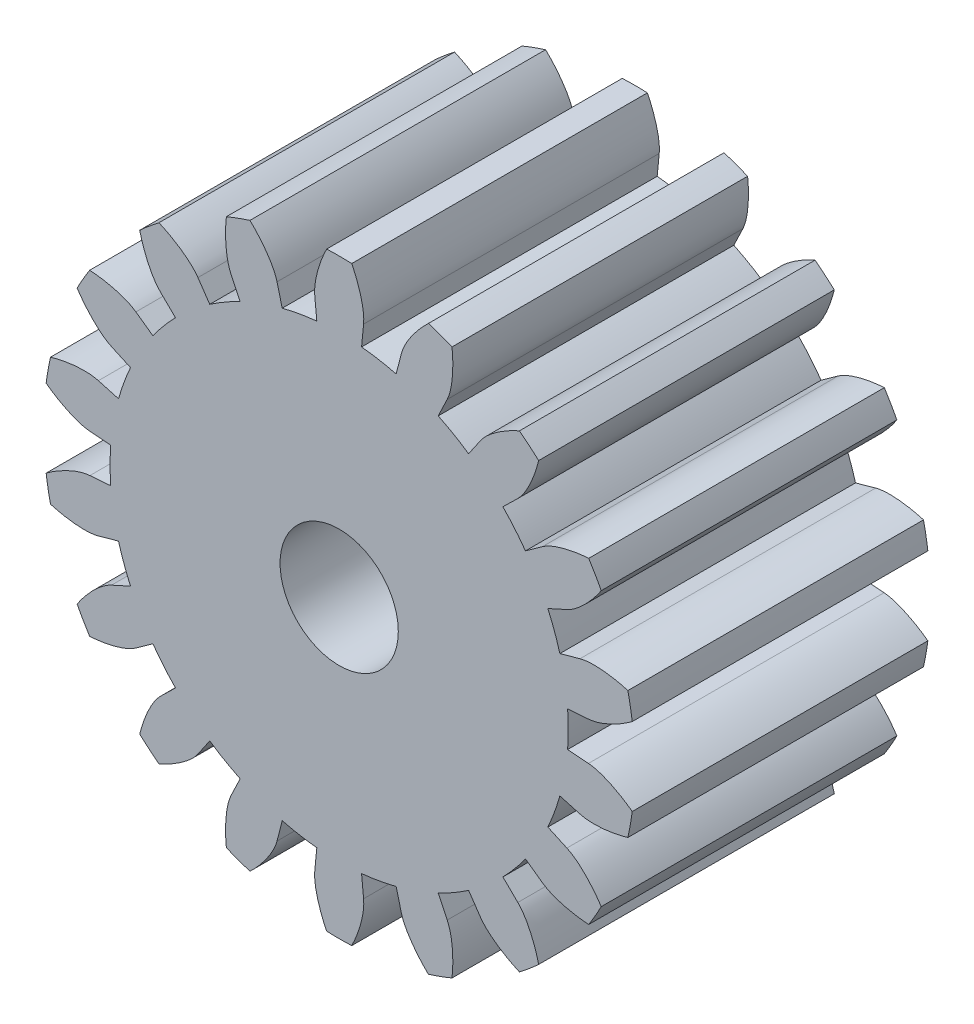
from build123d import *

# Parameters (mm, degrees)
SKETCH_1_R               = 5
SKETCH_1_R_2             = 1
EXTRUDE_1_DEPTH          = 5
CUT_EXTRUDE_1_DEPTH      = 9.660254038
PATTERN_CIRCULAR_1_COUNT = 18
PATTERN_CIRCULAR_1_ANGLE = 340


with BuildPart() as part:
    # 草图1 → 凸台-拉伸1 (new body)
    with BuildSketch(Plane.XY):
        Circle(SKETCH_1_R)
        Circle(SKETCH_1_R_2, mode=Mode.SUBTRACT)
    extrude(amount=EXTRUDE_1_DEPTH)

    # 草图1<3> → 切除-拉伸1 (cut, through all)
    with BuildSketch(Plane.XY):
        with BuildLine():
            Line((4.216167683, 0.324237649), (3.863591943, 0.297123374))
            ThreePointArc((3.863591943, 0.297123374), (3.872146935, 0.14867115), (3.875, 0))
            ThreePointArc((3.875, 0), (3.872146935, -0.14867115), (3.863591943, -0.297123374))
            Line((3.863591943, -0.297123374), (4.216167683, -0.324237649))
            add(Edge.make_bspline(
                [(4.216167683, -0.324237649), (4.248306389, -0.326709225), (4.337481239, -0.340286167), (4.502360973, -0.392611203), (4.68808741, -0.481175676), (4.835513121, -0.572403241), (4.929530291, -0.638831397), (4.956443154, -0.658537214)],
                knots=[0, 0, 0, 0, 0, 0.005604068, 0.015718248, 0.029959916, 0.035770965, 0.035770965, 0.035770965, 0.035770965, 0.035770965], degree=4))
            ThreePointArc((4.956443154, -0.658537214), (4.989098905, -0.329988053), (5, 0))
            ThreePointArc((5, 0), (4.989098905, 0.329988053), (4.956443154, 0.658537214))
            add(Edge.make_bspline(
                [(4.216167683, 0.324237649), (4.248306389, 0.326709225), (4.337481239, 0.340286167), (4.502360973, 0.392611203), (4.68808741, 0.481175676), (4.835513121, 0.572403241), (4.929530291, 0.638831397), (4.956443154, 0.658537214)],
                knots=[0, 0, 0, 0, 0, 0.005604068, 0.015718248, 0.029959916, 0.035770965, 0.035770965, 0.035770965, 0.035770965, 0.035770965], degree=4))
        make_face()
    cut_extrude_1 = extrude(amount=CUT_EXTRUDE_1_DEPTH, mode=Mode.SUBTRACT)

    # 阵列(圆周)1: 切除-拉伸1 ×18 about axis
    pattern_circular_1_axis = Axis((0, 0, 5), (0, 0, 1))
    for i in range(1, PATTERN_CIRCULAR_1_COUNT):
        add(cut_extrude_1.rotate(pattern_circular_1_axis, i * PATTERN_CIRCULAR_1_ANGLE / (PATTERN_CIRCULAR_1_COUNT - 1)), mode=Mode.SUBTRACT)


solid = part.part
